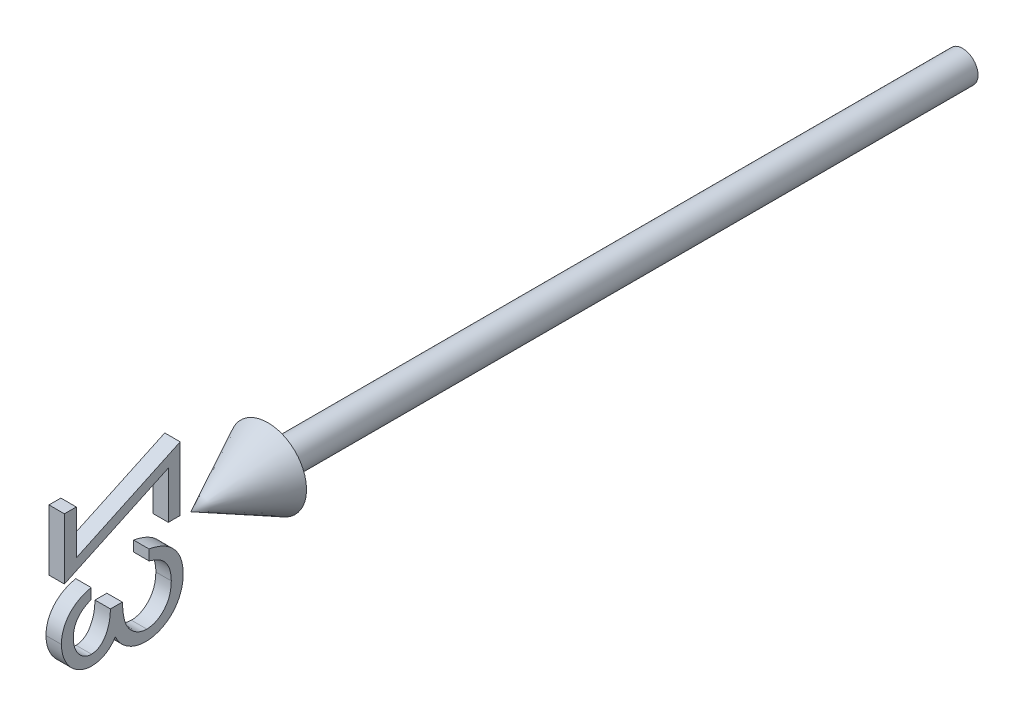
from build123d import *

# Parameters (mm, degrees)
BOSS_EXTRUDE1_DEPTH        = 1
BOSS_EXTRUDE1_DEPTH_BACK   = 1
BOSS_EXTRUDE1_2_DEPTH      = 1
BOSS_EXTRUDE1_2_DEPTH_BACK = 1


with BuildPart() as part:
    # Sketch2 → Revolve1 (revolve)
    with BuildSketch(Plane(origin=(0, 0, 0), x_dir=(1, 0, 0), z_dir=(0, 1, 0))):
        Polygon((0, -100), (5, -90), (2, -90), (2, 0), (0, 0), align=None)
    revolve(axis=Axis((0, 0, -41.949952025), (0, 0, 1)))


with BuildPart() as body_2:
    # Sketch3 → Boss-Extrude1 (new, two sides: drawn at the far end of the back side and taken through both)
    with BuildSketch(Plane(origin=(0, 0, 0), x_dir=(0, -1, 0), z_dir=(1, 0, 0)).offset(-BOSS_EXTRUDE1_DEPTH_BACK)):
        Polygon((-8.958586521, -115.829050545), (-8.958586521, -117.367512083), (-1.073971137, -117.367512083), (-7.366038444, -103.905973622), (-1.266278829, -103.905973622), (-1.266278829, -102.367512083), (-9.535509598, -102.367512083), (-3.243442291, -115.829050545), align=None)
    extrude(amount=BOSS_EXTRUDE1_DEPTH + BOSS_EXTRUDE1_DEPTH_BACK)


with BuildPart() as body_3:
    # Sketch3 → Boss-Extrude1 2 (new, two sides: drawn at the far end of the back side and taken through both)
    with BuildSketch(Plane(origin=(0, 0, 0), x_dir=(0, -1, 0), z_dir=(1, 0, 0)).offset(-BOSS_EXTRUDE1_2_DEPTH_BACK)):
        with BuildLine():
            Line((2.387567325, -113.905973622), (1.041413479, -113.905973622))
            add(Edge.make_bspline(
                [(1.041413479, -113.905973622), (1.077882982, -114.056969982), (1.149177877, -114.352155515), (1.297881763, -114.773900918), (1.459878571, -115.173001724), (1.654403305, -115.541984897), (1.86658368, -115.888265909), (2.109681058, -116.203990728), (2.372479869, -116.497189151), (2.663158223, -116.757388741), (2.967995345, -116.99300758), (3.291286572, -117.193900683), (3.626527545, -117.366718481), (3.976040972, -117.509090904), (4.340867422, -117.616343148), (4.717708665, -117.694158029), (5.107552237, -117.744691376), (5.372184768, -117.749623217), (5.506557709, -117.752127468)],
                knots=[0, 0, 0, 0, 1.162005537, 2.271625781, 3.343758855, 4.383309926, 5.390229558, 6.379919256, 7.361854164, 8.333198761, 9.295911338, 10.242430842, 11.177959212, 12.116337295, 13.062827104, 14.020064771, 14.994644689, 16, 16, 16, 16], degree=3))
            add(Edge.make_bspline(
                [(5.506557709, -117.752127468), (5.70234089, -117.746216481), (6.089636651, -117.734523443), (6.658621138, -117.627747287), (7.207307505, -117.458782434), (7.729689996, -117.225323603), (8.21491185, -116.937377976), (8.646638365, -116.59467196), (9.019017697, -116.203817811), (9.331422172, -115.772106821), (9.576029311, -115.310726067), (9.756399483, -114.83586825), (9.866206688, -114.348659801), (9.880437645, -114.019700034), (9.887567325, -113.854891891)],
                knots=[0, 0, 0, 0, 1.083050992, 2.142477498, 3.193116406, 4.255571735, 5.30263384, 6.308962982, 7.297363603, 8.282367274, 9.249857812, 10.179914175, 11.08814088, 12, 12, 12, 12], degree=3))
            add(Edge.make_bspline(
                [(9.887567325, -113.854891891), (9.882580506, -113.696291342), (9.872822076, -113.38593468), (9.789963337, -112.93284255), (9.650522211, -112.50580712), (9.457366086, -112.103030711), (9.20733087, -111.727067111), (8.904447884, -111.377070436), (8.546579333, -111.05148833), (8.275383884, -110.864976303), (8.13576444, -110.768954391)],
                knots=[0, 0, 0, 0, 1.024540389, 2.004866551, 2.965041327, 3.920577974, 4.882998113, 5.874504559, 6.905732034, 8, 8, 8, 8], degree=3))
            add(Edge.make_bspline(
                [(8.13576444, -110.768954391), (8.295532489, -110.692184402), (8.612592213, -110.539834344), (9.040398309, -110.236305231), (9.434677535, -109.894456112), (9.651975175, -109.624703167), (9.761365402, -109.488906314)],
                knots=[0, 0, 0, 0, 1.015663554, 2.015584519, 3.001021554, 4, 4, 4, 4], degree=3))
            add(Edge.make_bspline(
                [(9.761365402, -109.488906314), (9.833571964, -109.39009791), (9.976802655, -109.194099157), (10.153097142, -108.878789192), (10.314859216, -108.561028199), (10.43391142, -108.228322228), (10.536648754, -107.891358382), (10.604246499, -107.542920918), (10.647641548, -107.186320288), (10.653735099, -106.94496298), (10.656798094, -106.823641891)],
                knots=[0, 0, 0, 0, 1.02516404, 2.033540309, 3.025129118, 4.011046665, 4.991655828, 5.976607087, 6.982917762, 8, 8, 8, 8], degree=3))
            add(Edge.make_bspline(
                [(10.656798094, -106.823641891), (10.649089282, -106.613609657), (10.633707934, -106.194533605), (10.496818218, -105.575214797), (10.283287572, -104.970945972), (9.98569722, -104.390296807), (9.615837461, -103.848679978), (9.178243054, -103.362685267), (8.672448055, -102.948748493), (8.113179027, -102.599825571), (7.504922756, -102.323308091), (6.856929846, -102.124054834), (6.173036865, -102.004530828), (5.705353383, -101.990190179), (5.467495209, -101.982896699)],
                knots=[0, 0, 0, 0, 0.955619592, 1.906742024, 2.874954321, 3.868585453, 4.869520953, 5.854611167, 6.836527075, 7.836578462, 8.849204403, 9.870874567, 10.917152508, 12, 12, 12, 12], degree=3))
            add(Edge.make_bspline(
                [(5.467495209, -101.982896699), (5.307136874, -101.986650067), (4.991605144, -101.994035444), (4.527560673, -102.043624388), (4.085547169, -102.136656874), (3.661272508, -102.253658099), (3.261140023, -102.415425402), (2.879394184, -102.608281996), (2.517708313, -102.837173435), (2.178230348, -103.102484648), (1.861322974, -103.399460875), (1.575059945, -103.733035725), (1.316274062, -104.096983533), (1.086609618, -104.49457807), (0.885100046, -104.92470573), (0.716081847, -105.389090113), (0.568508081, -105.884131107), (0.4997621, -106.229020322), (0.464490402, -106.405973622)],
                knots=[0, 0, 0, 0, 1.048603596, 2.063302207, 3.045874044, 3.999447474, 4.937100059, 5.862643889, 6.7929026, 7.7308982, 8.676022965, 9.627908155, 10.600123445, 11.591992905, 12.626222643, 13.701663232, 14.820785756, 16, 16, 16, 16], degree=3))
            Line((0.464490402, -106.405973622), (1.810644248, -106.405973622))
            add(Edge.make_bspline(
                [(1.810644248, -106.405973622), (1.845715497, -106.29047785), (1.913932123, -106.065828544), (2.030050543, -105.742512948), (2.162343137, -105.446121291), (2.304262674, -105.17447934), (2.453313157, -104.924911901), (2.620091408, -104.704018176), (2.792244887, -104.502095881), (2.922013544, -104.388333258), (2.985524056, -104.332656314)],
                knots=[0, 0, 0, 0, 1.198163088, 2.33053128, 3.407730985, 4.417276592, 5.372219308, 6.28897303, 7.162600585, 8, 8, 8, 8], degree=3))
            add(Edge.make_bspline(
                [(2.985524056, -104.332656314), (3.069518764, -104.267933011), (3.237248909, -104.138686191), (3.510400544, -103.973278506), (3.79867748, -103.831693482), (4.104483743, -103.71660724), (4.427860356, -103.630219356), (4.767495568, -103.568041423), (5.123946634, -103.526994326), (5.367217522, -103.523264335), (5.491533671, -103.521358237)],
                knots=[0, 0, 0, 0, 0.946083416, 1.889246487, 2.84504177, 3.809995578, 4.801312957, 5.829064617, 6.89060985, 8, 8, 8, 8], degree=3))
            add(Edge.make_bspline(
                [(5.491533671, -103.521358237), (5.631907725, -103.523993538), (5.906397071, -103.529146642), (6.306891349, -103.576673932), (6.68801812, -103.645589983), (7.045887986, -103.753388087), (7.385370678, -103.88270972), (7.698887961, -104.052015473), (7.995656856, -104.243218949), (8.266983406, -104.465625366), (8.511597558, -104.70602263), (8.722971211, -104.961062702), (8.90604497, -105.222837682), (9.05320572, -105.497454251), (9.16961678, -105.78221864), (9.248816734, -106.078196726), (9.303898319, -106.382896188), (9.308383304, -106.590020761), (9.310644248, -106.69443516)],
                knots=[0, 0, 0, 0, 1.216990249, 2.379719373, 3.493992396, 4.571561497, 5.616923107, 6.638958652, 7.655775068, 8.674704564, 9.676001865, 10.625896028, 11.54399481, 12.441854662, 13.322657739, 14.20572845, 15.095482574, 16, 16, 16, 16], degree=3))
            add(Edge.make_bspline(
                [(9.310644248, -106.69443516), (9.304072128, -106.83418926), (9.290960591, -107.113002062), (9.191271648, -107.523351764), (9.025831107, -107.918874931), (8.798724763, -108.29439185), (8.51564065, -108.638351807), (8.189960141, -108.946233046), (7.814734235, -109.202591552), (7.467421351, -109.379219207), (7.158983186, -109.496899238), (6.895561346, -109.579420134), (6.600388976, -109.645384256), (6.277012802, -109.709192001), (5.924067986, -109.762684208), (5.541236851, -109.807486076), (5.128365289, -109.84327828), (4.842546582, -109.859270854), (4.695259633, -109.867512083)],
                knots=[0, 0, 0, 0, 1.070440979, 2.135555593, 3.216243406, 4.345886539, 5.486149072, 6.621334998, 7.769144672, 8.957074012, 9.598644492, 10.297969361, 11.070758978, 11.915404831, 12.824182859, 13.805940418, 14.869366021, 16, 16, 16, 16], degree=3))
            Line((4.695259633, -109.867512083), (4.695259633, -111.405973622))
            add(Edge.make_bspline(
                [(4.695259633, -111.405973622), (4.880763881, -111.409590344), (5.243994071, -111.416672137), (5.776072015, -111.484686812), (6.283308569, -111.59508424), (6.758074146, -111.749213391), (7.18856769, -111.93685345), (7.565618942, -112.146938636), (7.875663405, -112.389305252), (8.124254, -112.652496293), (8.308636345, -112.936567256), (8.444736501, -113.231298035), (8.525236874, -113.542171637), (8.536002291, -113.754284118), (8.541413479, -113.860901506)],
                knots=[0, 0, 0, 0, 1.321816535, 2.58820849, 3.816448615, 5.017641336, 6.139869627, 7.160068286, 8.085608132, 8.934319198, 9.728416342, 10.48890201, 11.240453369, 12, 12, 12, 12], degree=3))
            add(Edge.make_bspline(
                [(8.541413479, -113.860901506), (8.539676508, -113.939247922), (8.536220886, -114.095114401), (8.490900512, -114.323542955), (8.425944751, -114.544991506), (8.33157719, -114.756872574), (8.209531247, -114.959859711), (8.061873825, -115.15469429), (7.888230891, -115.343236811), (7.689730048, -115.521328974), (7.468198023, -115.681615074), (7.232526248, -115.824507899), (6.98179593, -115.944660423), (6.717641012, -116.044258706), (6.438633609, -116.119048711), (6.146241516, -116.172783695), (5.839863659, -116.206370876), (5.630842238, -116.211207327), (5.524586556, -116.213665929)],
                knots=[0, 0, 0, 0, 0.884246871, 1.759167212, 2.622361933, 3.489113179, 4.372562419, 5.294145153, 6.247651513, 7.265905295, 8.30305477, 9.334068495, 10.37719476, 11.441246459, 12.52060732, 13.637552802, 14.799054011, 16, 16, 16, 16], degree=3))
            add(Edge.make_bspline(
                [(5.524586556, -116.213665929), (5.353788049, -116.207714516), (5.02017884, -116.196090021), (4.539336404, -116.093915952), (4.092789714, -115.932031673), (3.752611213, -115.736556886), (3.500985165, -115.544262062), (3.317728145, -115.378830826), (3.141049606, -115.191265687), (2.977882574, -114.976421945), (2.818449734, -114.741687207), (2.664273432, -114.485768642), (2.520305814, -114.205017615), (2.432670368, -114.007585402), (2.387567325, -113.905973622)],
                knots=[0, 0, 0, 0, 1.4727372, 2.876598283, 4.222346151, 5.558423782, 6.24313385, 6.953189256, 7.68715613, 8.463578749, 9.278833271, 10.135787152, 11.040551781, 12, 12, 12, 12], degree=3))
        make_face()
    extrude(amount=BOSS_EXTRUDE1_2_DEPTH + BOSS_EXTRUDE1_2_DEPTH_BACK)


solid = Compound([part.part, body_2.part, body_3.part])
